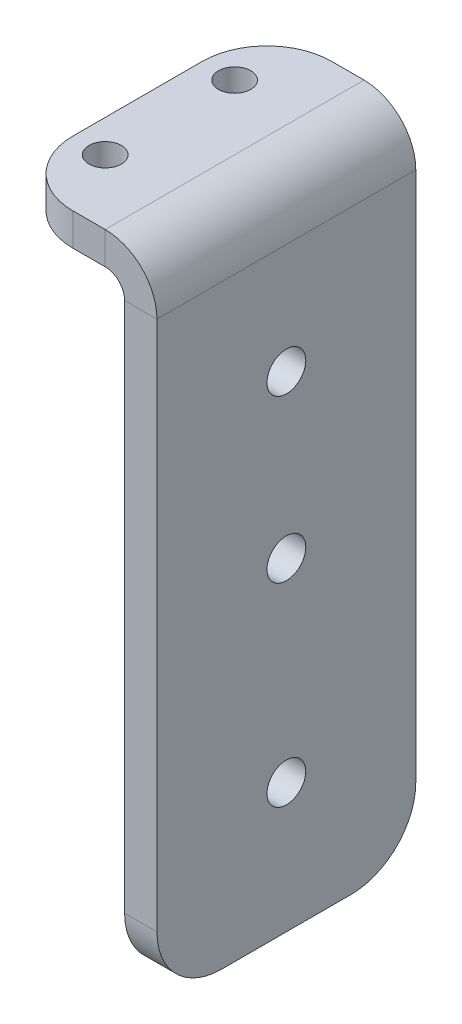
from build123d import *

# Parameters (mm, degrees)
SKETCH1_W                    = 40
SKETCH1_H                    = 100
BASE_FLANGE1_DEPTH           = 5
EDGE_FLANGE1_STRIP_W         = 26
EDGE_FLANGE1_STRIP_H         = 5
EDGE_FLANGE1_STRIP_CUT_DEPTH = 40
EDGE_FLANGE1_DEPTH           = 40
SKETCH9_R                    = 2.5
CUT_EXTRUDE1_DEPTH           = 10
FILLET1_R                    = 10
SKETCH16_R                   = 3
CUT_EXTRUDE2_DEPTH           = 10


# Sheet-metal steps are written as plain solids
with BuildPart() as part:
    # Sketch1 → Base-Flange1 (new body)
    with BuildSketch(Plane(origin=(0, 0, 0), x_dir=(0, 0, -1), z_dir=(1, 0, 0))):
        Rectangle(SKETCH1_W, SKETCH1_H)
    extrude(amount=-BASE_FLANGE1_DEPTH)

    # Edge-Flange1 strip (across the edge) → Edge-Flange1 strip cut (cut)
    with BuildSketch(Plane(origin=(-5, 50, 20), x_dir=(0, -1, 0), z_dir=(0, 0, -1))):
        with Locations((-5, -2.5)):
            Rectangle(EDGE_FLANGE1_STRIP_W, EDGE_FLANGE1_STRIP_H)
    extrude(amount=EDGE_FLANGE1_STRIP_CUT_DEPTH, mode=Mode.SUBTRACT)

    # Edge-Flange1 section (across the edge) → Edge-Flange1 (add)
    with BuildSketch(Plane(origin=(-5, 50, 20), x_dir=(0, -1, 0), z_dir=(0, 0, -1))):
        with BuildLine():
            Line((0, 3), (0, 18))
            Line((0, 18), (5, 18))
            Line((5, 18), (5, 3))
            ThreePointArc((5, 3), (5.878679656, 0.878679656), (8, 0))
            Line((8, 0), (8, -5))
            ThreePointArc((8, -5), (2.343145751, -2.656854249), (0, 3))
        make_face()
    extrude(amount=EDGE_FLANGE1_DEPTH)

    # Sketch9 → Cut-Extrude1 (cut)
    with BuildSketch(Plane(origin=(0, 50, 0), x_dir=(1, 0, 0), z_dir=(0, 1, 0))):
        with Locations(Location((-18, 10, 0), (0, 0, 180))):
            Circle(SKETCH9_R)
        with Locations(Location((-18, -10, 0), (0, 0, 180))):
            Circle(SKETCH9_R)
    extrude(amount=-CUT_EXTRUDE1_DEPTH, mode=Mode.SUBTRACT)

    # Fillet1
    fillet1_edges = [part.edges().sort_by_distance(p)[0] for p in [
        (-23, 47.5, 20),
        (-23, 47.5, -20),
        (-2.5, -50, -20),
        (-2.5, -50, 20),
    ]]
    fillet(fillet1_edges, radius=FILLET1_R)

    # Sketch16 → Cut-Extrude2 (cut)
    with BuildSketch(Plane(origin=(0, 0, 0), x_dir=(0, 0, -1), z_dir=(1, 0, 0))):
        Circle(SKETCH16_R)
        with Locations((0, -30)):
            Circle(SKETCH16_R)
        with Locations((0, 25)):
            Circle(SKETCH16_R)
    extrude(amount=-CUT_EXTRUDE2_DEPTH, mode=Mode.SUBTRACT)


solid = part.part
